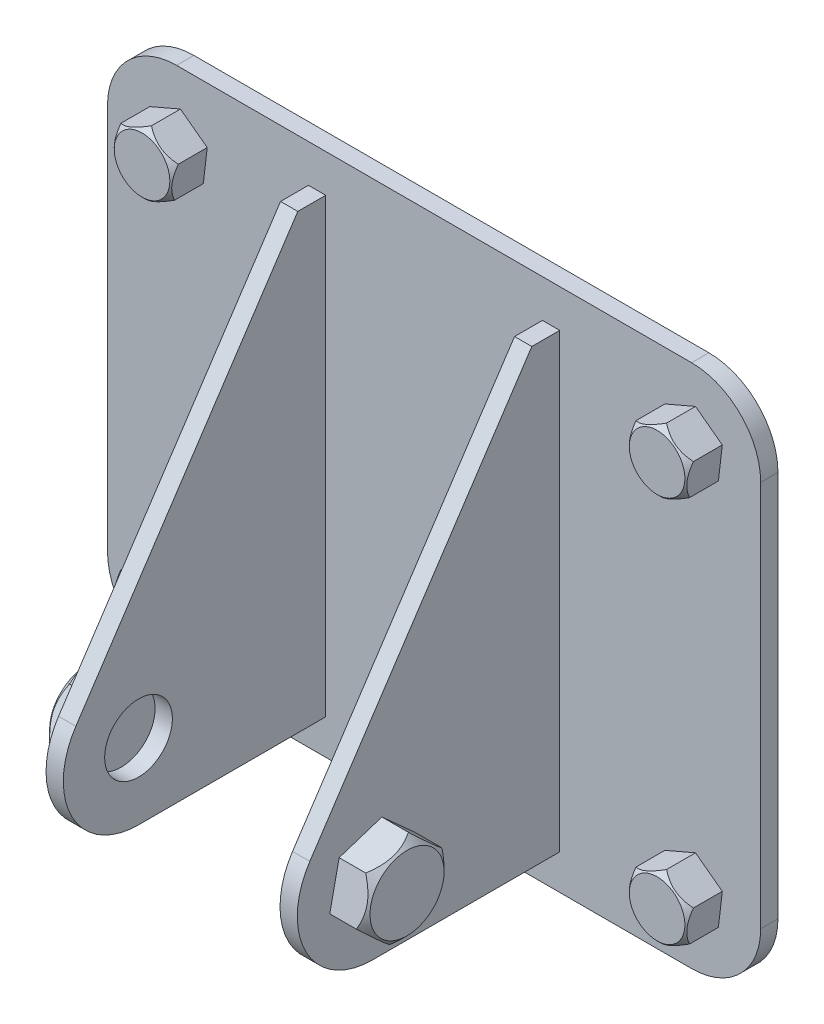
from build123d import *

# Parameters (mm, degrees)
SKETCH1_W           = 189.169200237
SKETCH1_H           = 151.960639362
BOSS_EXTRUDE1_DEPTH = 5
SKETCH2_W           = 5
SKETCH2_H           = 130.805658789
BOSS_EXTRUDE2_DEPTH = 76
SKETCH3_R           = 9.810131349
CUT_EXTRUDE1_DEPTH  = 244
FILLET1_R           = 20
BOSS_EXTRUDE3_DEPTH = 10
SKETCH5_R           = 15.360463603
SKETCH5_R_2         = 10.755153569
CUT_EXTRUDE2_DEPTH  = 10
CUT_EXTRUDE2_TAPER  = 45
BOSS_EXTRUDE4_DEPTH = 10
SKETCH8_R           = 15.27610718
SKETCH8_R_2         = 10.726840036
CUT_EXTRUDE3_DEPTH  = 10
CUT_EXTRUDE3_TAPER  = 45
BOSS_EXTRUDE5_DEPTH = 10
SKETCH10_R          = 11.300300546
SKETCH10_R_2        = 8.050906131
CUT_EXTRUDE5_DEPTH  = 10
CUT_EXTRUDE5_TAPER  = 45


with BuildPart() as part:
    # Sketch1 → Boss-Extrude1 (new body)
    with BuildSketch(Plane.XY):
        with Locations((5.000168563, 145.667152335)):
            Rectangle(SKETCH1_W, SKETCH1_H)
    extrude(amount=BOSS_EXTRUDE1_DEPTH)

    # Sketch2 → Boss-Extrude2 (add)
    with BuildSketch(Plane.XY.offset(5)):
        with Locations((38.883568004, 145.262674653)):
            Rectangle(SKETCH2_W, SKETCH2_H)
        with Locations((-28.883230877, 145.262674653)):
            Rectangle(SKETCH2_W, SKETCH2_H)
    extrude(amount=BOSS_EXTRUDE2_DEPTH)

    # Sketch3 → Cut-Extrude1 (cut)
    with BuildSketch(Plane.ZY.offset(31.383230877)):
        with Locations((59.220022764, 101.639822494)):
            Circle(SKETCH3_R)
        with BuildLine():
            Line((59.220022764, 79.859845258), (59.220022764, 69.562908795))
            Line((59.220022764, 69.562908795), (98.459320981, 69.562908795))
            Line((98.459320981, 69.562908795), (93.498838554, 226.992956324))
            Line((93.498838554, 226.992956324), (13.086807644, 210.665504047))
            Line((13.086807644, 210.665504047), (77.374336815, 113.672623071))
            ThreePointArc((77.374336815, 113.672623071), (78.409102094, 91.337073207), (59.220022764, 79.859845258))
        make_face()
    extrude(amount=-CUT_EXTRUDE1_DEPTH, mode=Mode.SUBTRACT)

    # Fillet1
    fillet1_edges = [part.edges().sort_by_distance(p)[0] for p in [
        (-89.584431555, 69.686832654, 2.5),
        (99.584768682, 69.686832654, 2.5),
        (99.584768682, 221.647472016, 2.5),
        (-89.584431555, 221.647472016, 2.5),
    ]]
    fillet(fillet1_edges, radius=FILLET1_R)

    # Sketch4 → Boss-Extrude3 (add)
    with BuildSketch(Plane.ZY.offset(31.383230877)):
        Polygon((66.573996471, 112.582825248), (53.420091239, 113.48005192), (46.066117532, 102.537049167), (51.866049057, 90.696819741), (65.019954288, 89.799593068), (72.373927996, 100.742595822), align=None)
    extrude(amount=BOSS_EXTRUDE3_DEPTH)

    # Sketch5 → Cut-Extrude2 (cut)
    with BuildSketch(Plane.ZY.offset(41.383230877)):
        with Locations((59.220022764, 101.639822494)):
            Circle(SKETCH5_R)
        with Locations((59.220022764, 101.639822494)):
            Circle(SKETCH5_R_2, mode=Mode.SUBTRACT)
    extrude(amount=-CUT_EXTRUDE2_DEPTH, taper=CUT_EXTRUDE2_TAPER, mode=Mode.SUBTRACT)

    # Sketch6 → Boss-Extrude4 (add)
    with BuildSketch(Plane(origin=(41.383568004, 0, 0), x_dir=(0, 0, -1), z_dir=(1, 0, 0))):
        Polygon((-46.841819788, 105.652658791), (-56.50613945, 114.366078873), (-68.884342426, 110.353242576), (-71.59822574, 97.626986197), (-61.933906078, 88.913566116), (-49.555703102, 92.926402412), align=None)
    extrude(amount=BOSS_EXTRUDE4_DEPTH)

    # Sketch8 → Cut-Extrude3 (cut)
    with BuildSketch(Plane(origin=(51.383568004, 0, 0), x_dir=(0, 0, -1), z_dir=(1, 0, 0))):
        with Locations((-59.220022764, 101.639822494)):
            Circle(SKETCH8_R)
        with Locations((-59.220022764, 101.639822494)):
            Circle(SKETCH8_R_2, mode=Mode.SUBTRACT)
    extrude(amount=-CUT_EXTRUDE3_DEPTH, taper=CUT_EXTRUDE3_TAPER, mode=Mode.SUBTRACT)

    # Sketch9 → Boss-Extrude5 (add)
    with BuildSketch(Plane.XY.offset(5)):
        Polygon((80.708970652, 211.254394975), (71.827030332, 207.424520961), (70.702828362, 197.817598002), (78.460566712, 192.040549058), (87.342507031, 195.870423072), (88.466709001, 205.477346031), align=None)
        Polygon((-60.702491236, 205.477346031), (-68.460229585, 211.254394975), (-77.342169904, 207.424520961), (-78.466371874, 197.817598002), (-70.708633525, 192.040549058), (-61.826693206, 195.870423072), align=None)
        Polygon((80.708970652, 99.293755613), (71.827030332, 95.463881598), (70.702828362, 85.85695864), (78.460566712, 80.079909695), (87.342507031, 83.909783709), (88.466709001, 93.516706668), align=None)
        Polygon((-68.460229585, 99.293755613), (-77.342169904, 95.463881598), (-78.466371874, 85.85695864), (-70.708633525, 80.079909695), (-61.826693206, 83.909783709), (-60.702491236, 93.516706668), align=None)
    extrude(amount=BOSS_EXTRUDE5_DEPTH)

    # Sketch10 → Cut-Extrude5 (cut)
    # profile 1 of 4: a face of its own
    with BuildSketch(Plane.XY.offset(15)):
        with Locations((-69.584431555, 201.647472016)):
            Circle(SKETCH10_R)
        with Locations((-69.584431555, 201.647472016)):
            Circle(SKETCH10_R_2, mode=Mode.SUBTRACT)
    # profile 2 of 4: a face of its own
    with BuildSketch(Plane.XY.offset(15)):
        with Locations((79.584768682, 201.647472016)):
            Circle(SKETCH10_R)
        with Locations((79.584768682, 201.647472016)):
            Circle(SKETCH10_R_2, mode=Mode.SUBTRACT)
    # profile 3 of 4: a face of its own
    with BuildSketch(Plane.XY.offset(15)):
        with Locations((79.584768682, 89.686832654)):
            Circle(SKETCH10_R)
        with Locations((79.584768682, 89.686832654)):
            Circle(SKETCH10_R_2, mode=Mode.SUBTRACT)
    # profile 4 of 4: a face of its own
    with BuildSketch(Plane.XY.offset(15)):
        with Locations((-69.584431555, 89.686832654)):
            Circle(SKETCH10_R)
        with Locations((-69.584431555, 89.686832654)):
            Circle(SKETCH10_R_2, mode=Mode.SUBTRACT)
    extrude(amount=-CUT_EXTRUDE5_DEPTH, taper=CUT_EXTRUDE5_TAPER, mode=Mode.SUBTRACT)


solid = part.part
